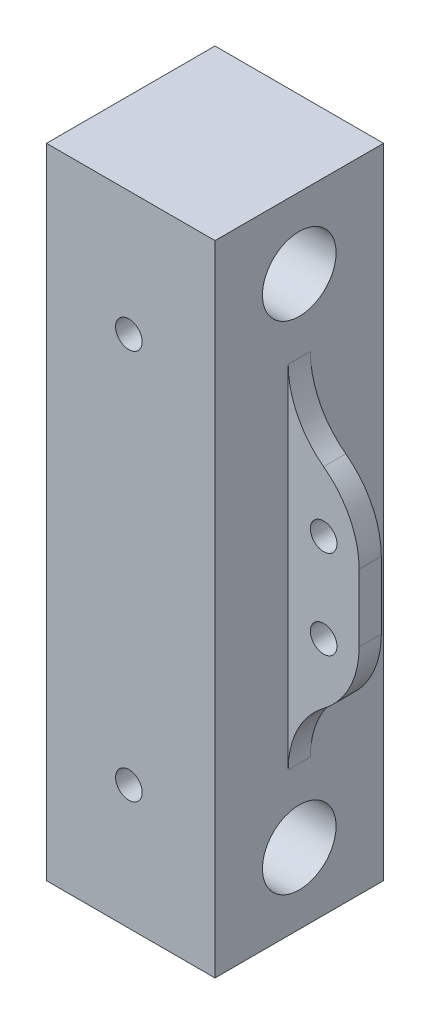
from build123d import *

# Parameters (mm, degrees)
SKETCH1_W           = 19
SKETCH1_H           = 19
BOSS_EXTRUDE1_DEPTH = 72
SKETCH2_R           = 4.15
CUT_EXTRUDE1_DEPTH  = 77.850504227
SKETCH3_R           = 1.5
CUT_EXTRUDE2_DEPTH  = 77.850504227
SKETCH4_W           = 2.5
SKETCH4_H           = 20
BOSS_EXTRUDE2_DEPTH = 8
FILLET1_R           = 10
FILLET2_R           = 10
SKETCH5_R           = 1.5
CUT_EXTRUDE3_DEPTH  = 10


with BuildPart() as part:
    # Sketch1 → Boss-Extrude1 (new body)
    with BuildSketch(Plane(origin=(0, 0, 0), x_dir=(1, 0, 0), z_dir=(0, 1, 0))):
        with Locations((9.5, 9.5)):
            Rectangle(SKETCH1_W, SKETCH1_H)
    extrude(amount=BOSS_EXTRUDE1_DEPTH)

    # Sketch2 → Cut-Extrude1 (cut, through all)
    with BuildSketch(Plane(origin=(19, 0, 0), x_dir=(0, 0, -1), z_dir=(1, 0, 0))):
        with Locations((9.5, 64)):
            Circle(SKETCH2_R)
        with Locations((9.5, 8)):
            Circle(SKETCH2_R)
    extrude(amount=-CUT_EXTRUDE1_DEPTH, mode=Mode.SUBTRACT)

    # Sketch3 → Cut-Extrude2 (cut, through all)
    with BuildSketch(Plane.XY):
        with Locations((9.290763855, 58)):
            Circle(SKETCH3_R)
        with Locations((9.290763855, 14)):
            Circle(SKETCH3_R)
    extrude(amount=-CUT_EXTRUDE2_DEPTH, mode=Mode.SUBTRACT)

    # Sketch4 → Boss-Extrude2 (add)
    with BuildSketch(Plane(origin=(19, 0, 0), x_dir=(0, 0, -1), z_dir=(1, 0, 0))):
        with Locations((9.5, 36)):
            Rectangle(SKETCH4_W, SKETCH4_H)
    extrude(amount=BOSS_EXTRUDE2_DEPTH)

    # Fillet1
    # the kernel refuses this fillet: 10 mm, written as the material it adds along each edge
    with BuildSketch(Plane(origin=(19, 46, -8.25), x_dir=(0, 1, 0), z_dir=(0, 0, -1)), Plane(origin=(19, 26, -10.75), x_dir=(0, -1, 0), z_dir=(0, 0, 1))) as fillet1_piece_1:
        with BuildLine():
            CenterArc((9.797958971, 10), FILLET1_R, 191.536959033, 78.463040967)
            Line((0, 8), (-0.195959179, 7.96))
            ThreePointArc((-0.195959179, 7.96), (-0.2, 4), (-0.2, 0))
            Line((-0.2, 0), (0, -0.2))
            Line((0, -0.2), (9.797958971, -0.2))
            Line((9.797958971, -0.2), (9.797958971, 0))
        make_face()
    extrude(amount=2.5)

    # Fillet2
    fillet2_edges = [part.edges().sort_by_distance(p)[0] for p in [
        (27, 46, -9.5),
        (27, 26, -9.5),
    ]]
    fillet(fillet2_edges, radius=FILLET2_R)

    # Sketch5 → Cut-Extrude3 (cut)
    with BuildSketch(Plane(origin=(0, 0, -10.75), x_dir=(-1, 0, 0), z_dir=(0, 0, -1))):
        with Locations((-23, 41)):
            Circle(SKETCH5_R)
        with Locations((-23, 31)):
            Circle(SKETCH5_R)
    extrude(amount=-CUT_EXTRUDE3_DEPTH, mode=Mode.SUBTRACT)


solid = part.part
